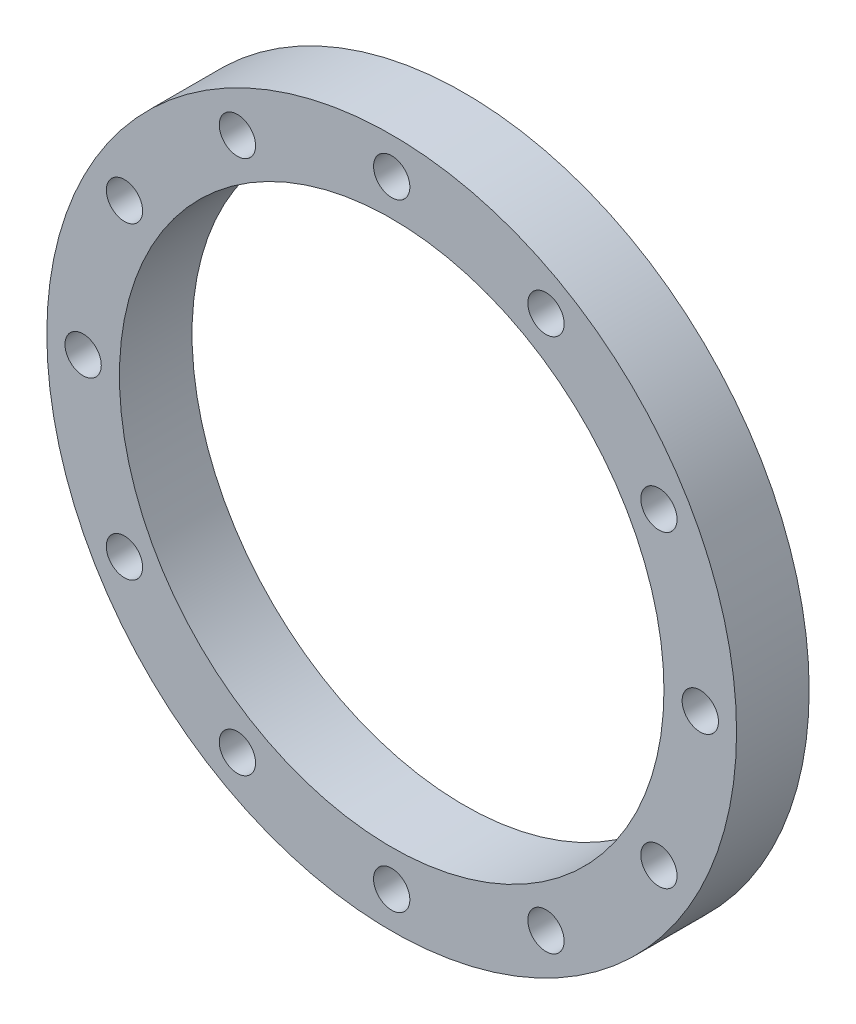
from build123d import *

# Parameters (mm, degrees)
SKETCH1_R           = 241.3
SKETCH1_R_2         = 190.5
SKETCH1_R_3         = 12.7
BOSS_EXTRUDE1_DEPTH = 50.8


with BuildPart() as part:
    # Sketch1 → Boss-Extrude1 (new body)
    with BuildSketch(Plane.XY):
        Circle(SKETCH1_R)
        Circle(SKETCH1_R_2, mode=Mode.SUBTRACT)
        with Locations((0, 215.9)):
            Circle(SKETCH1_R_3, mode=Mode.SUBTRACT)
        with Locations((107.95, 186.974884677)):
            Circle(SKETCH1_R_3, mode=Mode.SUBTRACT)
        with Locations((186.974884677, 107.95)):
            Circle(SKETCH1_R_3, mode=Mode.SUBTRACT)
        with Locations((215.9, 0)):
            Circle(SKETCH1_R_3, mode=Mode.SUBTRACT)
        with Locations((186.974884677, -107.95)):
            Circle(SKETCH1_R_3, mode=Mode.SUBTRACT)
        with Locations((107.95, -186.974884677)):
            Circle(SKETCH1_R_3, mode=Mode.SUBTRACT)
        with Locations((0, -215.9)):
            Circle(SKETCH1_R_3, mode=Mode.SUBTRACT)
        with Locations((-107.95, -186.974884677)):
            Circle(SKETCH1_R_3, mode=Mode.SUBTRACT)
        with Locations((-186.974884677, -107.95)):
            Circle(SKETCH1_R_3, mode=Mode.SUBTRACT)
        with Locations((-215.9, 0)):
            Circle(SKETCH1_R_3, mode=Mode.SUBTRACT)
        with Locations((-186.974884677, 107.95)):
            Circle(SKETCH1_R_3, mode=Mode.SUBTRACT)
        with Locations((-107.95, 186.974884677)):
            Circle(SKETCH1_R_3, mode=Mode.SUBTRACT)
    extrude(amount=BOSS_EXTRUDE1_DEPTH)


solid = part.part
